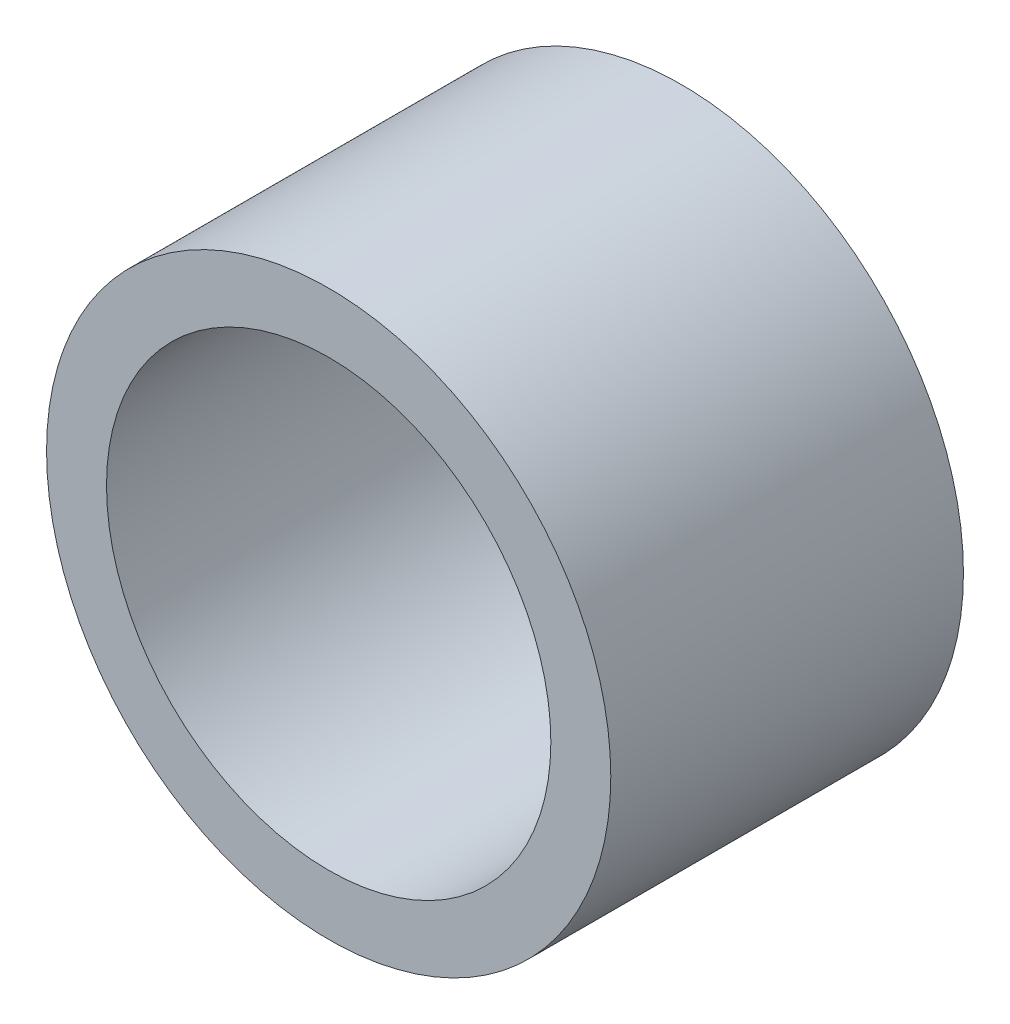
from build123d import *

# Parameters (mm, degrees)
SKETCH1_R           = 20.32
SKETCH1_R_2         = 16.002
BOSS_EXTRUDE1_DEPTH = 12.7


with BuildPart() as part:
    # Sketch1 → Boss-Extrude1 (new, symmetric)
    with BuildSketch(Plane.XY):
        Circle(SKETCH1_R)
        Circle(SKETCH1_R_2, mode=Mode.SUBTRACT)
    extrude(amount=BOSS_EXTRUDE1_DEPTH, both=True)


solid = part.part
